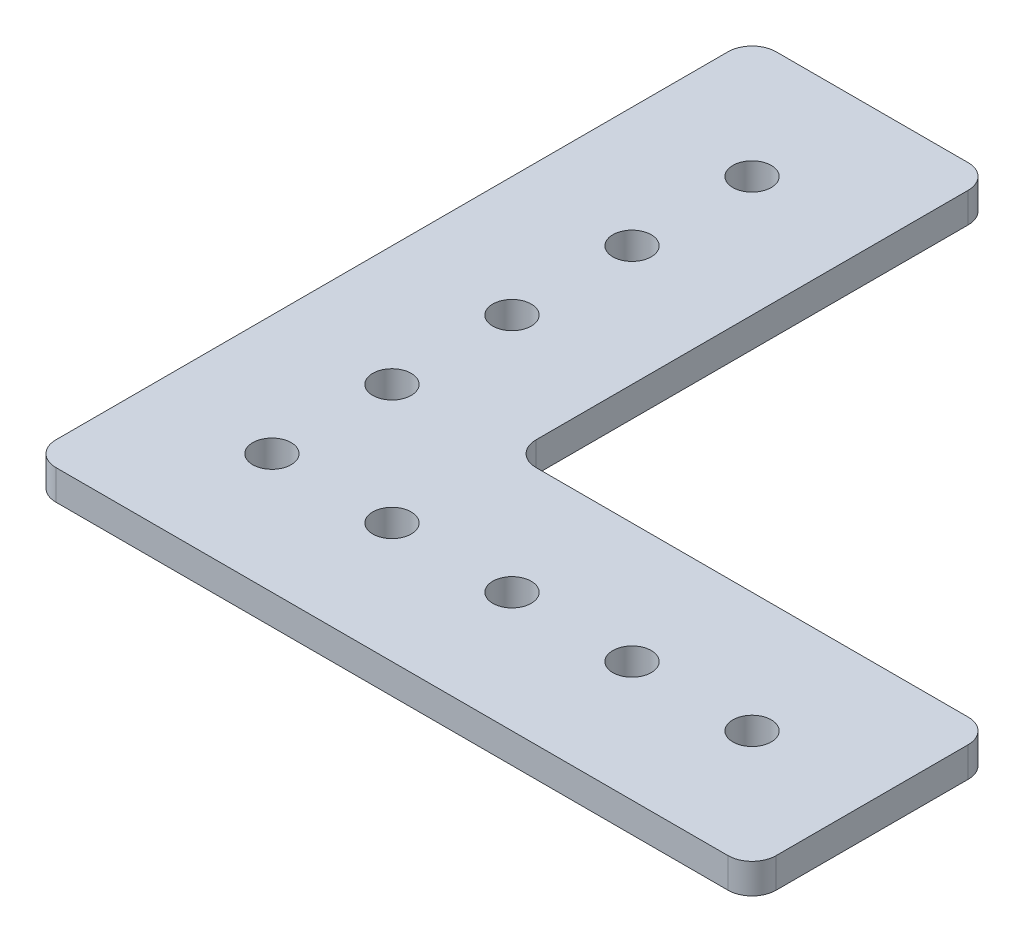
from build123d import *

# Parameters (mm, degrees)
SKETCH1_R           = 2.032
BOSS_EXTRUDE1_DEPTH = 3.175


with BuildPart() as part:
    # Sketch1 → Boss-Extrude1 (new body)
    with BuildSketch(Plane(origin=(0, 0, 0), x_dir=(1, 0, 0), z_dir=(0, 1, 0))):
        with BuildLine():
            ThreePointArc((0, 2.54), (0.743948776, 0.743948776), (2.54, 0))
            Line((2.54, 0), (25.4, 0))
            Line((25.4, 0), (73.66, 0))
            ThreePointArc((73.66, 0), (75.456051224, 0.743948776), (76.2, 2.54))
            Line((76.2, 2.54), (76.2, 22.86))
            ThreePointArc((76.2, 22.86), (75.456051224, 24.656051224), (73.66, 25.4))
            Line((73.66, 25.4), (27.94, 25.4))
            ThreePointArc((27.94, 25.4), (26.143948776, 26.143948776), (25.4, 27.94))
            Line((25.4, 27.94), (25.4, 73.66))
            ThreePointArc((25.4, 73.66), (24.656051224, 75.456051224), (22.86, 76.2))
            Line((22.86, 76.2), (2.54, 76.2))
            ThreePointArc((2.54, 76.2), (0.743948776, 75.456051224), (0, 73.66))
            Line((0, 73.66), (0, 25.4))
            Line((0, 25.4), (0, 2.54))
        make_face()
        with Locations((12.7, 12.7)):
            Circle(SKETCH1_R, mode=Mode.SUBTRACT)
        with Locations((25.4, 12.7)):
            Circle(SKETCH1_R, mode=Mode.SUBTRACT)
        with Locations((38.1, 12.7)):
            Circle(SKETCH1_R, mode=Mode.SUBTRACT)
        with Locations((12.7, 25.4)):
            Circle(SKETCH1_R, mode=Mode.SUBTRACT)
        with Locations((12.7, 38.1)):
            Circle(SKETCH1_R, mode=Mode.SUBTRACT)
        with Locations((50.8, 12.7)):
            Circle(SKETCH1_R, mode=Mode.SUBTRACT)
        with Locations((63.5, 12.7)):
            Circle(SKETCH1_R, mode=Mode.SUBTRACT)
        with Locations((12.7, 50.8)):
            Circle(SKETCH1_R, mode=Mode.SUBTRACT)
        with Locations((12.7, 63.5)):
            Circle(SKETCH1_R, mode=Mode.SUBTRACT)
    extrude(amount=BOSS_EXTRUDE1_DEPTH)


solid = part.part
